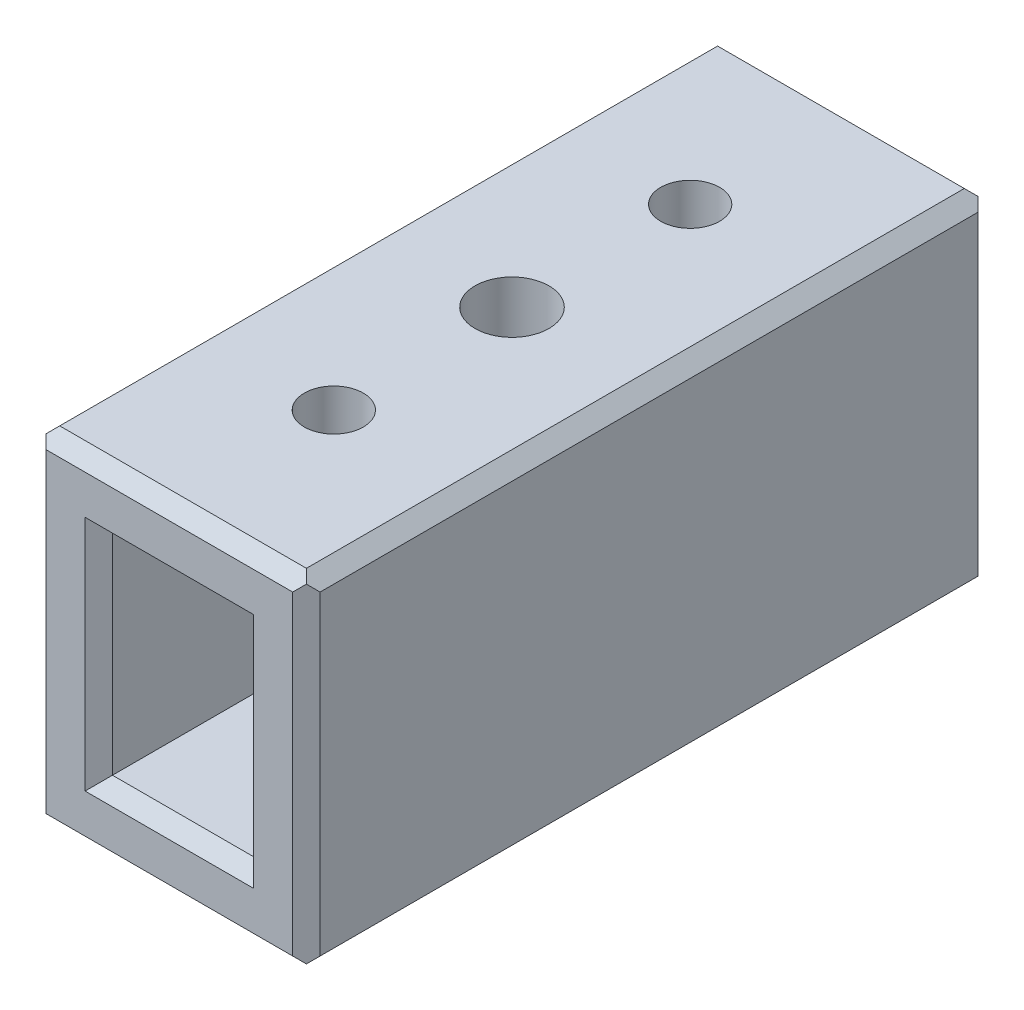
from build123d import *

# Parameters (mm, degrees)
SKETCH_2_W          = 20
SKETCH_2_H          = 25
SKETCH_2_W_2        = 10.3
SKETCH_2_H_2        = 15.3
EXTRUDE_1_DEPTH     = 50
SKETCH_3_R          = 2.15
SKETCH_3_R_2        = 2.7
CUT_EXTRUDE_2_DEPTH = 57.789083458
CHAMFER_1_SIZE      = 1
CHAMFER_2_SIZE      = 1


with BuildPart() as part:
    # 草图2 → 凸台-拉伸1 (new body)
    with BuildSketch(Plane.XY):
        Rectangle(SKETCH_2_W, SKETCH_2_H)
        Rectangle(SKETCH_2_W_2, SKETCH_2_H_2, mode=Mode.SUBTRACT)
    extrude(amount=-EXTRUDE_1_DEPTH)

    # 草图3 → 切除-拉伸2 (cut, through all)
    with BuildSketch(Plane(origin=(0, 12.5, 0), x_dir=(1, 0, 0), z_dir=(0, 1, 0))):
        with Locations((0, 38)):
            Circle(SKETCH_3_R)
        with Locations((0, 12)):
            Circle(SKETCH_3_R)
        with Locations((0, 25)):
            Circle(SKETCH_3_R_2)
    extrude(amount=-CUT_EXTRUDE_2_DEPTH, mode=Mode.SUBTRACT)

    # 倒角1
    chamfer_1_edges = [part.edges().sort_by_distance(p)[0] for p in [
        (0, 12.5, -50),
        (-10, 0, -50),
        (0, -12.5, -50),
        (10, 0, -50),
        (5.15, 0, -50),
        (0, -7.65, -50),
        (-5.15, 0, -50),
        (0, 7.65, -50),
        (0, -12.5, 0),
        (-10, 0, 0),
        (0, 12.5, 0),
        (10, 0, 0),
        (0, -7.65, 0),
        (5.15, 0, 0),
        (0, 7.65, 0),
        (-5.15, 0, 0),
    ]]
    chamfer(chamfer_1_edges, length=CHAMFER_1_SIZE)

    # 倒角2
    chamfer_2_edges = [part.edges().sort_by_distance(p)[0] for p in [
        (10, -12.5, -25),
        (-10, -12.5, -25),
        (10, 12.5, -25),
        (-10, 12.5, -25),
    ]]
    chamfer(chamfer_2_edges, length=CHAMFER_2_SIZE)


solid = part.part
